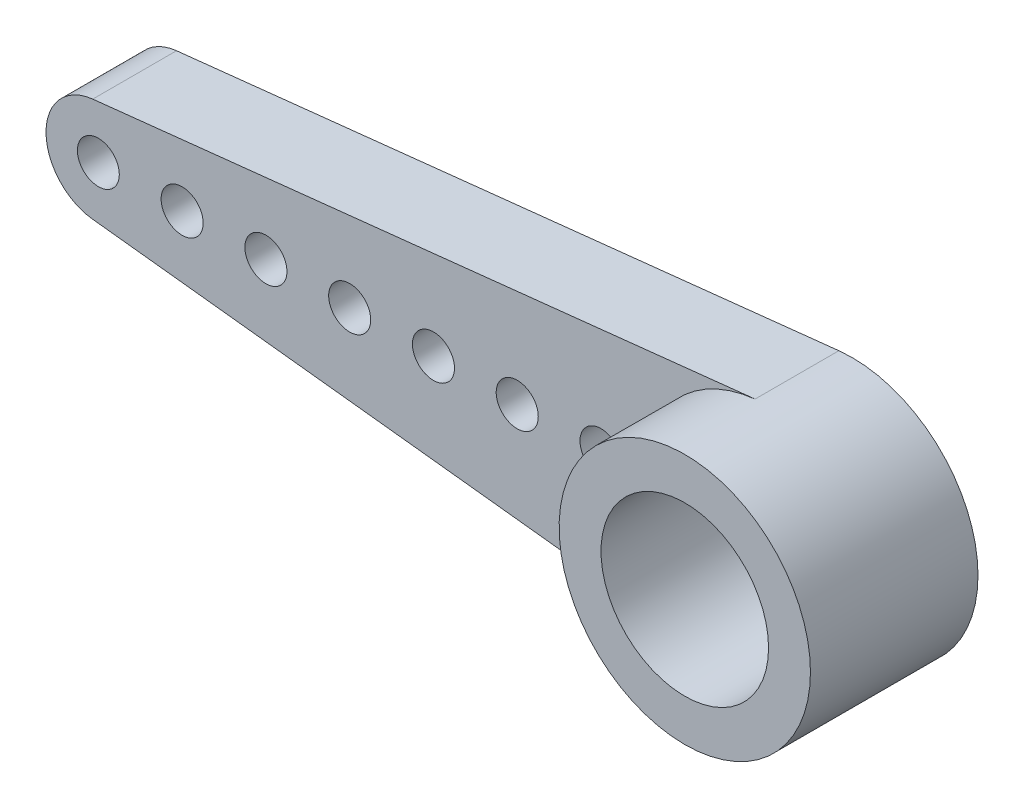
from build123d import *

# Parameters (mm, degrees)
SKETCH_1_R          = 2
EXTRUDE_1_DEPTH     = 4
SKETCH_1_3_R        = 0.5
EXTRUDE_2_DEPTH     = 2
SKETCH_2_R          = 0.502083319
CUT_EXTRUDE_1_DEPTH = 18.622783549


with BuildPart() as part:
    # 草图1 → 凸台-拉伸1 (new body)
    with BuildSketch(Plane.XY):
        with BuildLine():
            ThreePointArc((-0.321491523, 2.982724124), (-2.999992581, 0.006671881), (-0.334755231, -2.981264654))
            ThreePointArc((-0.334755231, -2.981264654), (1.999466717, -2.236544846), (3, 0))
            ThreePointArc((3, 0), (2.00443576, 2.23209258), (-0.321491523, 2.982724124))
        make_face()
        Circle(SKETCH_1_R, mode=Mode.SUBTRACT)
    extrude(amount=EXTRUDE_1_DEPTH)

    # 草图1<3> → 凸台-拉伸2 (add)
    with BuildSketch(Plane.XY):
        with BuildLine():
            ThreePointArc((-16.133954801, 1.278385172), (-17.249996909, 0.038363404), (-16.139481346, -1.206610152))
            Line((-16.139481346, -1.206610152), (-0.334755231, -2.981264654))
            ThreePointArc((-0.334755231, -2.981264654), (-2.999992581, 0.006671881), (-0.321491523, 2.982724124))
            Line((-0.321491523, 2.982724124), (-16.133954801, 1.278385172))
        make_face()
        with Locations((-16, 0.035583454)):
            Circle(SKETCH_1_3_R, mode=Mode.SUBTRACT)
    extrude(amount=EXTRUDE_2_DEPTH)

    # 草图2 → 切除-拉伸1 (cut, through all)
    with BuildSketch(Plane.XY.offset(2)):
        with Locations((-14, 0.031135522)):
            Circle(SKETCH_2_R)
        with Locations((-12, 0.031135522)):
            Circle(SKETCH_2_R)
        with Locations((-10, 0.031135522)):
            Circle(SKETCH_2_R)
        with Locations((-8, 0.031135522)):
            Circle(SKETCH_2_R)
        with Locations((-6, 0.031135522)):
            Circle(SKETCH_2_R)
        with Locations((-4, 0.031135522)):
            Circle(SKETCH_2_R)
    extrude(amount=-CUT_EXTRUDE_1_DEPTH, mode=Mode.SUBTRACT)


solid = part.part
